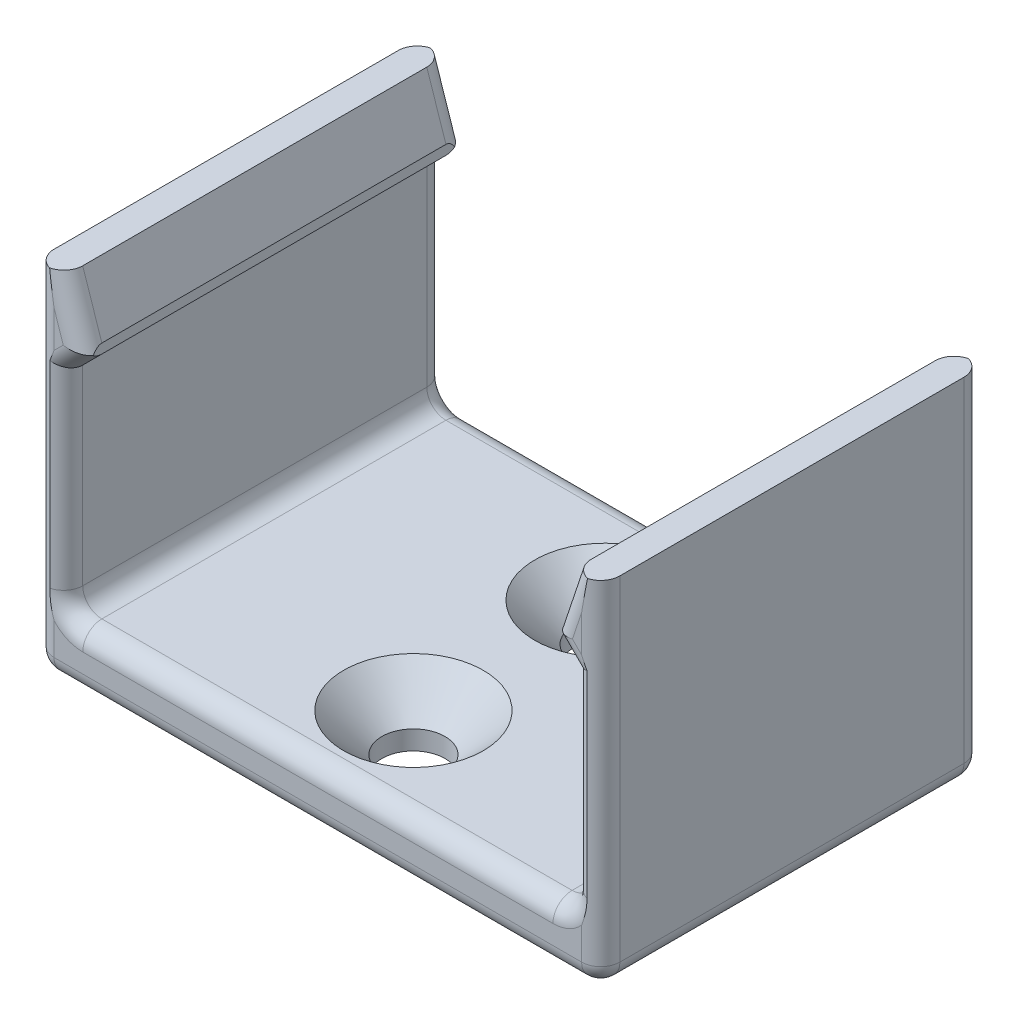
from build123d import *

# Parameters (mm, degrees)
BOSS_EXTRUDE1_DEPTH = 20
SKETCH2_R           = 1.65
CUT_EXTRUDE1_DEPTH  = 20
FILLET2_R           = 1
CHAMFER1_SIZE       = 2


with BuildPart() as part:
    # Sketch1 → Boss-Extrude1 (new body)
    with BuildSketch(Plane.XY):
        with BuildLine():
            Line((0, 0), (-12.3, 0))
            ThreePointArc((-12.3, 0), (-13.007106781, 0.292893219), (-13.3, 1))
            Line((-13.3, 1), (-13.3, 11))
            Line((-13.3, 11), (-12.3, 12))
            Line((-12.3, 12), (-12.3, 12.5))
            Line((-12.3, 12.5), (-13.3, 15.5))
            Line((-13.3, 15.5), (-14.8, 15.5))
            Line((-14.8, 15.5), (-14.8, -3))
            Line((-14.8, -3), (0, -3))
            Line((0, -3), (0, 0))
        make_face()
    boss_extrude1 = extrude(amount=BOSS_EXTRUDE1_DEPTH)

    # Mirror1: Boss-Extrude1 across plane
    add(boss_extrude1.mirror(Plane(origin=(0, 0, 20), x_dir=(0, 0, 1), z_dir=(-1, 0, 0))))

    # Sketch2 → Cut-Extrude1 (cut)
    with BuildSketch(Plane(origin=(0, 0, 0), x_dir=(1, 0, 0), z_dir=(0, 1, 0))):
        with Locations(Location((0, -5, 0), (0, 0, 180))):
            Circle(SKETCH2_R)
        with Locations(Location((0, -15, 0), (0, 0, 180))):
            Circle(SKETCH2_R)
    extrude(amount=-CUT_EXTRUDE1_DEPTH, mode=Mode.SUBTRACT)

    # Fillet2
    # the kernel refuses this fillet: 1 mm, written as the material it takes off along each edge
    with BuildSketch(Plane(origin=(-13.8, -2, 1), x_dir=(-1, 0, 0), z_dir=(0, 0, -1))) as fillet2_piece_1_section:
        Polygon((0, 0), (FILLET2_R, 0), (FILLET2_R, -FILLET2_R), (0, -FILLET2_R), align=None)
    fillet2_piece_1 = extrude(amount=FILLET2_R, mode=Mode.PRIVATE)
    fillet2_piece_1 = fillet2_piece_1 - Plane(origin=(-13.8, -2, 1), x_dir=(0.7071067811865475, 0.7071067811865475, 0), z_dir=(0, 0, -1)) * Sphere(FILLET2_R, mode=Mode.PRIVATE)
    add(fillet2_piece_1, mode=Mode.SUBTRACT)
    with BuildSketch(Plane(origin=(13.8, -2, 1), x_dir=(0, -1, 0), z_dir=(0, 0, -1))) as fillet2_piece_2_section:
        Polygon((0, 0), (FILLET2_R, 0), (FILLET2_R, -FILLET2_R), (0, -FILLET2_R), align=None)
    fillet2_piece_2 = extrude(amount=FILLET2_R, mode=Mode.PRIVATE)
    fillet2_piece_2 = fillet2_piece_2 - Plane(origin=(13.8, -2, 1), x_dir=(-0.7071067811865476, 0.7071067811865475, 0), z_dir=(0, 0, -1)) * Sphere(FILLET2_R, mode=Mode.PRIVATE)
    add(fillet2_piece_2, mode=Mode.SUBTRACT)
    with BuildSketch(Plane(origin=(13.8, -2, 19), x_dir=(0, -1, 0), z_dir=(0, 0, 1))) as fillet2_piece_3_section:
        Polygon((0, 0), (FILLET2_R, 0), (FILLET2_R, FILLET2_R), (0, FILLET2_R), align=None)
    fillet2_piece_3 = extrude(amount=FILLET2_R, mode=Mode.PRIVATE)
    fillet2_piece_3 = fillet2_piece_3 - Plane(origin=(13.8, -2, 19), x_dir=(-0.7071067811865476, 0.7071067811865475, 0), z_dir=(0, 0, 1)) * Sphere(FILLET2_R, mode=Mode.PRIVATE)
    add(fillet2_piece_3, mode=Mode.SUBTRACT)
    with BuildSketch(Plane(origin=(-13.8, -2, 19), x_dir=(-1, 0, 0), z_dir=(0, 0, 1))) as fillet2_piece_4_section:
        Polygon((0, 0), (FILLET2_R, 0), (FILLET2_R, FILLET2_R), (0, FILLET2_R), align=None)
    fillet2_piece_4 = extrude(amount=FILLET2_R, mode=Mode.PRIVATE)
    fillet2_piece_4 = fillet2_piece_4 - Plane(origin=(-13.8, -2, 19), x_dir=(0.7071067811865475, 0.7071067811865475, 0), z_dir=(0, 0, 1)) * Sphere(FILLET2_R, mode=Mode.PRIVATE)
    add(fillet2_piece_4, mode=Mode.SUBTRACT)
    with BuildSketch(Plane(origin=(-12.3, 1, 0), x_dir=(0, -1, 0), z_dir=(1, 0, 0))) as fillet2_piece_5:
        with BuildLine():
            CenterArc((1 + FILLET2_R, -FILLET2_R), FILLET2_R, 90, 90)
            Line((1 + FILLET2_R, 0), (1, 0))
            Line((1, 0), (1, -FILLET2_R))
        make_face()
    revolve(axis=Axis((-12.3, 1, 0), (0, 0, -1)), revolution_arc=90, mode=Mode.SUBTRACT)
    with BuildSketch(Plane(origin=(-13.3, 1, 0), x_dir=(-1, 0, 0), z_dir=(0, 1, 0))) as fillet2_piece_6_section:
        with BuildLine():
            CenterArc((FILLET2_R, FILLET2_R), FILLET2_R, 180, 90)
            Line((0, FILLET2_R), (0, 0))
            Line((0, 0), (FILLET2_R, 0))
        make_face()
    fillet2_piece_6 = extrude(amount=12.5, mode=Mode.PRIVATE)
    fillet2_piece_6 = split(fillet2_piece_6, bisect_by=Plane(origin=(-15.966229844, 8.333770156, 0.229204386), z_dir=(0.7071067811865476, -0.7071067811865476, 0)), keep=Keep.TOP, mode=Mode.PRIVATE)
    add(fillet2_piece_6, mode=Mode.SUBTRACT)
    with BuildSketch(Plane(origin=(-15.067766953, 9.232233047, 0), x_dir=(-0.7071067811865476, 0.7071067811865476, 0), z_dir=(0.7071067811865476, 0.7071067811865476, 0))) as fillet2_piece_7_section:
        with BuildLine():
            CenterArc((FILLET2_R, FILLET2_R), FILLET2_R, 180, 90)
            Line((0, FILLET2_R), (0, 0))
            Line((0, 0), (FILLET2_R, 0))
        make_face()
    fillet2_piece_7 = extrude(amount=6.414213562, mode=Mode.PRIVATE)
    fillet2_piece_7 = split(fillet2_piece_7, bisect_by=Plane(origin=(-13.3, 12.610644527, 0.233840359), z_dir=(1, 0, 0)), keep=Keep.TOP, mode=Mode.PRIVATE)
    add(fillet2_piece_7, mode=Mode.SUBTRACT)
    with BuildSketch(Plane(origin=(-11.509430585, 10.128291755, 0), x_dir=(-0.948683298050514, -0.31622776601683744, 0), z_dir=(-0.31622776601683744, 0.948683298050514, 0)), Plane(origin=(11.509430585, 10.128291755, 20), x_dir=(0.9486832980505141, -0.3162277660168372, 0), z_dir=(0.3162277660168372, 0.9486832980505141, 0))) as fillet2_piece_8:
        with BuildLine():
            CenterArc((FILLET2_R, FILLET2_R), FILLET2_R, 180, 90)
            Line((0, FILLET2_R), (0, 0))
            Line((0, 0), (FILLET2_R, 0))
        make_face()
    extrude(amount=8.16227766, mode=Mode.SUBTRACT)
    with BuildSketch(Plane(origin=(-14.8, 18, 0), x_dir=(1, 0, 0), z_dir=(0, -1, 0)), Plane(origin=(14.8, 18, 20), x_dir=(-1, 0, 0), z_dir=(0, -1, 0))) as fillet2_piece_9:
        with BuildLine():
            CenterArc((FILLET2_R, FILLET2_R), FILLET2_R, 180, 90)
            Line((0, FILLET2_R), (0, 0))
            Line((0, 0), (FILLET2_R, 0))
        make_face()
    extrude(amount=20, mode=Mode.SUBTRACT)
    with BuildSketch(Plane(origin=(13.8, -3, 0), x_dir=(0, 1, 0), z_dir=(-1, 0, 0)), Plane(origin=(-13.8, -3, 20), x_dir=(0, 1, 0), z_dir=(1, 0, 0))) as fillet2_piece_10:
        with BuildLine():
            CenterArc((FILLET2_R, -FILLET2_R), FILLET2_R, 90, 90)
            Line((0, -FILLET2_R), (0, 0))
            Line((0, 0), (FILLET2_R, 0))
        make_face()
    extrude(amount=27.6, mode=Mode.SUBTRACT)
    with BuildSketch(Plane(origin=(14.8, 18, 0), x_dir=(-1, 0, 0), z_dir=(0, -1, 0)), Plane(origin=(-14.8, 18, 20), x_dir=(1, 0, 0), z_dir=(0, -1, 0))) as fillet2_piece_11:
        with BuildLine():
            CenterArc((FILLET2_R, -FILLET2_R), FILLET2_R, 90, 90)
            Line((0, -FILLET2_R), (0, 0))
            Line((0, 0), (FILLET2_R, 0))
        make_face()
    extrude(amount=20, mode=Mode.SUBTRACT)
    with BuildSketch(Plane(origin=(11.509430585, 10.128291755, 0), x_dir=(0.9486832980505141, -0.3162277660168372, 0), z_dir=(0.3162277660168372, 0.9486832980505141, 0)), Plane(origin=(-11.509430585, 10.128291755, 20), x_dir=(-0.948683298050514, -0.31622776601683744, 0), z_dir=(-0.31622776601683744, 0.948683298050514, 0))) as fillet2_piece_12:
        with BuildLine():
            CenterArc((FILLET2_R, -FILLET2_R), FILLET2_R, 90, 90)
            Line((0, -FILLET2_R), (0, 0))
            Line((0, 0), (FILLET2_R, 0))
        make_face()
    extrude(amount=8.16227766, mode=Mode.SUBTRACT)
    with BuildSketch(Plane(origin=(15.067766953, 9.232233047, 0), x_dir=(0.7071067811865474, 0.7071067811865478, 0), z_dir=(-0.7071067811865478, 0.7071067811865474, 0))) as fillet2_piece_13_section:
        with BuildLine():
            CenterArc((FILLET2_R, -FILLET2_R), FILLET2_R, 90, 90)
            Line((0, -FILLET2_R), (0, 0))
            Line((0, 0), (FILLET2_R, 0))
        make_face()
    fillet2_piece_13 = extrude(amount=6.414213562, mode=Mode.PRIVATE)
    fillet2_piece_13 = split(fillet2_piece_13, bisect_by=Plane(origin=(13.3, 12.610644527, 0.233840359), z_dir=(-1, 0, 0)), keep=Keep.TOP, mode=Mode.PRIVATE)
    add(fillet2_piece_13, mode=Mode.SUBTRACT)
    with BuildSketch(Plane(origin=(15.067766953, 9.232233047, 20), x_dir=(0.7071067811865474, 0.7071067811865478, 0), z_dir=(-0.7071067811865478, 0.7071067811865474, 0))) as fillet2_piece_14_section:
        with BuildLine():
            CenterArc((FILLET2_R, FILLET2_R), FILLET2_R, 180, 90)
            Line((0, FILLET2_R), (0, 0))
            Line((0, 0), (FILLET2_R, 0))
        make_face()
    fillet2_piece_14 = extrude(amount=6.414213562, mode=Mode.PRIVATE)
    fillet2_piece_14 = split(fillet2_piece_14, bisect_by=Plane(origin=(13.3, 12.610644527, 19.766159641), z_dir=(-1, 0, 0)), keep=Keep.TOP, mode=Mode.PRIVATE)
    add(fillet2_piece_14, mode=Mode.SUBTRACT)
    with BuildSketch(Plane(origin=(13.3, 1, 0), x_dir=(1, 0, 0), z_dir=(0, 1, 0))) as fillet2_piece_15_section:
        with BuildLine():
            CenterArc((FILLET2_R, -FILLET2_R), FILLET2_R, 90, 90)
            Line((0, -FILLET2_R), (0, 0))
            Line((0, 0), (FILLET2_R, 0))
        make_face()
    fillet2_piece_15 = extrude(amount=12.5, mode=Mode.PRIVATE)
    fillet2_piece_15 = split(fillet2_piece_15, bisect_by=Plane(origin=(15.966229844, 8.333770156, 0.229204386), z_dir=(-0.7071067811865474, -0.7071067811865478, 0)), keep=Keep.TOP, mode=Mode.PRIVATE)
    add(fillet2_piece_15, mode=Mode.SUBTRACT)
    with BuildSketch(Plane(origin=(13.3, 1, 20), x_dir=(1, 0, 0), z_dir=(0, 1, 0))) as fillet2_piece_16_section:
        with BuildLine():
            CenterArc((FILLET2_R, FILLET2_R), FILLET2_R, 180, 90)
            Line((0, FILLET2_R), (0, 0))
            Line((0, 0), (FILLET2_R, 0))
        make_face()
    fillet2_piece_16 = extrude(amount=12.5, mode=Mode.PRIVATE)
    fillet2_piece_16 = split(fillet2_piece_16, bisect_by=Plane(origin=(15.966229844, 8.333770156, 19.770795614), z_dir=(-0.7071067811865474, -0.7071067811865478, 0)), keep=Keep.TOP, mode=Mode.PRIVATE)
    add(fillet2_piece_16, mode=Mode.SUBTRACT)
    with BuildSketch(Plane(origin=(12.3, 1, 0), x_dir=(0, -1, 0), z_dir=(-1, 0, 0))) as fillet2_piece_17:
        with BuildLine():
            CenterArc((1 + FILLET2_R, FILLET2_R), FILLET2_R, 180, 90)
            Line((1, FILLET2_R), (1, 0))
            Line((1, 0), (1 + FILLET2_R, 0))
        make_face()
    revolve(axis=Axis((12.3, 1, 0), (0, 0, 1)), revolution_arc=90, mode=Mode.SUBTRACT)
    with BuildSketch(Plane(origin=(12.3, 1, 20), x_dir=(0, -1, 0), z_dir=(-1, 0, 0))) as fillet2_piece_18:
        with BuildLine():
            CenterArc((1 + FILLET2_R, -FILLET2_R), FILLET2_R, 90, 90)
            Line((1, -FILLET2_R), (1, 0))
            Line((1, 0), (1 + FILLET2_R, 0))
        make_face()
    revolve(axis=Axis((12.3, 1, 20), (0, 0, 1)), revolution_arc=90, mode=Mode.SUBTRACT)
    with BuildSketch(Plane(origin=(12.3, 0, 0), x_dir=(0, 0, 1), z_dir=(-1, 0, 0)), Plane(origin=(-12.3, 0, 20), x_dir=(0, 0, -1), z_dir=(1, 0, 0))) as fillet2_piece_19:
        with BuildLine():
            CenterArc((FILLET2_R, -FILLET2_R), FILLET2_R, 90, 90)
            Line((0, -FILLET2_R), (0, 0))
            Line((0, 0), (FILLET2_R, 0))
        make_face()
    extrude(amount=24.6, mode=Mode.SUBTRACT)
    with BuildSketch(Plane(origin=(-15.067766953, 9.232233047, 20), x_dir=(-0.7071067811865476, 0.7071067811865476, 0), z_dir=(0.7071067811865476, 0.7071067811865476, 0))) as fillet2_piece_20_section:
        with BuildLine():
            CenterArc((FILLET2_R, -FILLET2_R), FILLET2_R, 90, 90)
            Line((0, -FILLET2_R), (0, 0))
            Line((0, 0), (FILLET2_R, 0))
        make_face()
    fillet2_piece_20 = extrude(amount=6.414213562, mode=Mode.PRIVATE)
    fillet2_piece_20 = split(fillet2_piece_20, bisect_by=Plane(origin=(-13.3, 12.610644527, 19.766159641), z_dir=(1, 0, 0)), keep=Keep.TOP, mode=Mode.PRIVATE)
    add(fillet2_piece_20, mode=Mode.SUBTRACT)
    with BuildSketch(Plane(origin=(-13.3, 1, 20), x_dir=(-1, 0, 0), z_dir=(0, 1, 0))) as fillet2_piece_21_section:
        with BuildLine():
            CenterArc((FILLET2_R, -FILLET2_R), FILLET2_R, 90, 90)
            Line((0, -FILLET2_R), (0, 0))
            Line((0, 0), (FILLET2_R, 0))
        make_face()
    fillet2_piece_21 = extrude(amount=12.5, mode=Mode.PRIVATE)
    fillet2_piece_21 = split(fillet2_piece_21, bisect_by=Plane(origin=(-15.966229844, 8.333770156, 19.770795614), z_dir=(0.7071067811865476, -0.7071067811865476, 0)), keep=Keep.TOP, mode=Mode.PRIVATE)
    add(fillet2_piece_21, mode=Mode.SUBTRACT)
    with BuildSketch(Plane(origin=(-12.3, 1, 20), x_dir=(0, -1, 0), z_dir=(1, 0, 0))) as fillet2_piece_22:
        with BuildLine():
            CenterArc((1 + FILLET2_R, FILLET2_R), FILLET2_R, 180, 90)
            Line((1 + FILLET2_R, 0), (1, 0))
            Line((1, 0), (1, FILLET2_R))
        make_face()
    revolve(axis=Axis((-12.3, 1, 20), (0, 0, -1)), revolution_arc=90, mode=Mode.SUBTRACT)
    with BuildSketch(Plane(origin=(14.8, -3, 1), x_dir=(-1, 0, 0), z_dir=(0, 0, 1)), Plane(origin=(-14.8, -3, 1), x_dir=(0, 1, 0), z_dir=(0, 0, 1))) as fillet2_piece_23:
        with BuildLine():
            CenterArc((FILLET2_R, -FILLET2_R), FILLET2_R, 90, 90)
            Line((0, -FILLET2_R), (0, 0))
            Line((0, 0), (FILLET2_R, 0))
        make_face()
    extrude(amount=18, mode=Mode.SUBTRACT)
    with BuildSketch(Plane(origin=(-13.3, 1, 0), x_dir=(-1, 0, 0), z_dir=(0, 1, 0))) as fillet2_piece_24a_section:
        with BuildLine():
            CenterArc((FILLET2_R, FILLET2_R), FILLET2_R, 180, 90)
            Line((0, FILLET2_R), (0, 0))
            Line((0, 0), (FILLET2_R, 0))
        make_face()
    fillet2_piece_24a = extrude(amount=12.5, mode=Mode.PRIVATE)
    fillet2_piece_24a = split(fillet2_piece_24a, bisect_by=Plane(origin=(-12.857581525, 11.442418475, 0.216324413), z_dir=(-0.7071067811865476, 0.7071067811865476, 0)), keep=Keep.TOP, mode=Mode.PRIVATE)
    with BuildSketch(Plane(origin=(-15.067766953, 9.232233047, 0), x_dir=(-0.7071067811865476, 0.7071067811865476, 0), z_dir=(0.7071067811865476, 0.7071067811865476, 0))) as fillet2_piece_24b_section:
        with BuildLine():
            CenterArc((FILLET2_R, FILLET2_R), FILLET2_R, 180, 90)
            Line((0, FILLET2_R), (0, 0))
            Line((0, 0), (FILLET2_R, 0))
        make_face()
    fillet2_piece_24b = extrude(amount=6.414213562, mode=Mode.PRIVATE)
    fillet2_piece_24b = split(fillet2_piece_24b, bisect_by=Plane(origin=(-13.3, 10.374325792, 0.216324413), z_dir=(-1, 0, 0)), keep=Keep.TOP, mode=Mode.PRIVATE)
    fillet2_piece_24 = fillet2_piece_24a & fillet2_piece_24b
    add(fillet2_piece_24, mode=Mode.SUBTRACT)
    with BuildSketch(Plane(origin=(15.067766953, 9.232233047, 0), x_dir=(0.7071067811865474, 0.7071067811865478, 0), z_dir=(-0.7071067811865478, 0.7071067811865474, 0))) as fillet2_piece_25a_section:
        with BuildLine():
            CenterArc((FILLET2_R, -FILLET2_R), FILLET2_R, 90, 90)
            Line((0, -FILLET2_R), (0, 0))
            Line((0, 0), (FILLET2_R, 0))
        make_face()
    fillet2_piece_25a = extrude(amount=6.414213562, mode=Mode.PRIVATE)
    fillet2_piece_25a = split(fillet2_piece_25a, bisect_by=Plane(origin=(13.3, 10.374325792, 0.216324413), z_dir=(1, 0, 0)), keep=Keep.TOP, mode=Mode.PRIVATE)
    with BuildSketch(Plane(origin=(13.3, 1, 0), x_dir=(1, 0, 0), z_dir=(0, 1, 0))) as fillet2_piece_25b_section:
        with BuildLine():
            CenterArc((FILLET2_R, -FILLET2_R), FILLET2_R, 90, 90)
            Line((0, -FILLET2_R), (0, 0))
            Line((0, 0), (FILLET2_R, 0))
        make_face()
    fillet2_piece_25b = extrude(amount=12.5, mode=Mode.PRIVATE)
    fillet2_piece_25b = split(fillet2_piece_25b, bisect_by=Plane(origin=(12.857581525, 11.442418475, 0.216324413), z_dir=(0.7071067811865474, 0.7071067811865478, 0)), keep=Keep.TOP, mode=Mode.PRIVATE)
    fillet2_piece_25 = fillet2_piece_25a & fillet2_piece_25b
    add(fillet2_piece_25, mode=Mode.SUBTRACT)
    with BuildSketch(Plane(origin=(15.067766953, 9.232233047, 20), x_dir=(0.7071067811865474, 0.7071067811865478, 0), z_dir=(-0.7071067811865478, 0.7071067811865474, 0))) as fillet2_piece_26a_section:
        with BuildLine():
            CenterArc((FILLET2_R, FILLET2_R), FILLET2_R, 180, 90)
            Line((0, FILLET2_R), (0, 0))
            Line((0, 0), (FILLET2_R, 0))
        make_face()
    fillet2_piece_26a = extrude(amount=6.414213562, mode=Mode.PRIVATE)
    fillet2_piece_26a = split(fillet2_piece_26a, bisect_by=Plane(origin=(13.3, 10.374325792, 19.783675587), z_dir=(1, 0, 0)), keep=Keep.TOP, mode=Mode.PRIVATE)
    with BuildSketch(Plane(origin=(13.3, 1, 20), x_dir=(1, 0, 0), z_dir=(0, 1, 0))) as fillet2_piece_26b_section:
        with BuildLine():
            CenterArc((FILLET2_R, FILLET2_R), FILLET2_R, 180, 90)
            Line((0, FILLET2_R), (0, 0))
            Line((0, 0), (FILLET2_R, 0))
        make_face()
    fillet2_piece_26b = extrude(amount=12.5, mode=Mode.PRIVATE)
    fillet2_piece_26b = split(fillet2_piece_26b, bisect_by=Plane(origin=(12.857581525, 11.442418475, 19.783675587), z_dir=(0.7071067811865474, 0.7071067811865478, 0)), keep=Keep.TOP, mode=Mode.PRIVATE)
    fillet2_piece_26 = fillet2_piece_26a & fillet2_piece_26b
    add(fillet2_piece_26, mode=Mode.SUBTRACT)
    with BuildSketch(Plane(origin=(-13.3, 1, 20), x_dir=(-1, 0, 0), z_dir=(0, 1, 0))) as fillet2_piece_27a_section:
        with BuildLine():
            CenterArc((FILLET2_R, -FILLET2_R), FILLET2_R, 90, 90)
            Line((0, -FILLET2_R), (0, 0))
            Line((0, 0), (FILLET2_R, 0))
        make_face()
    fillet2_piece_27a = extrude(amount=12.5, mode=Mode.PRIVATE)
    fillet2_piece_27a = split(fillet2_piece_27a, bisect_by=Plane(origin=(-12.857581525, 11.442418475, 19.783675587), z_dir=(-0.7071067811865476, 0.7071067811865476, 0)), keep=Keep.TOP, mode=Mode.PRIVATE)
    with BuildSketch(Plane(origin=(-15.067766953, 9.232233047, 20), x_dir=(-0.7071067811865476, 0.7071067811865476, 0), z_dir=(0.7071067811865476, 0.7071067811865476, 0))) as fillet2_piece_27b_section:
        with BuildLine():
            CenterArc((FILLET2_R, -FILLET2_R), FILLET2_R, 90, 90)
            Line((0, -FILLET2_R), (0, 0))
            Line((0, 0), (FILLET2_R, 0))
        make_face()
    fillet2_piece_27b = extrude(amount=6.414213562, mode=Mode.PRIVATE)
    fillet2_piece_27b = split(fillet2_piece_27b, bisect_by=Plane(origin=(-13.3, 10.374325792, 19.783675587), z_dir=(-1, 0, 0)), keep=Keep.TOP, mode=Mode.PRIVATE)
    fillet2_piece_27 = fillet2_piece_27a & fillet2_piece_27b
    add(fillet2_piece_27, mode=Mode.SUBTRACT)

    # Chamfer1
    chamfer1_edges = [part.edges().sort_by_distance(p)[0] for p in [
        (1.65, 0, 5),
        (1.65, 0, 15),
    ]]
    chamfer(chamfer1_edges, length=CHAMFER1_SIZE)


solid = part.part
